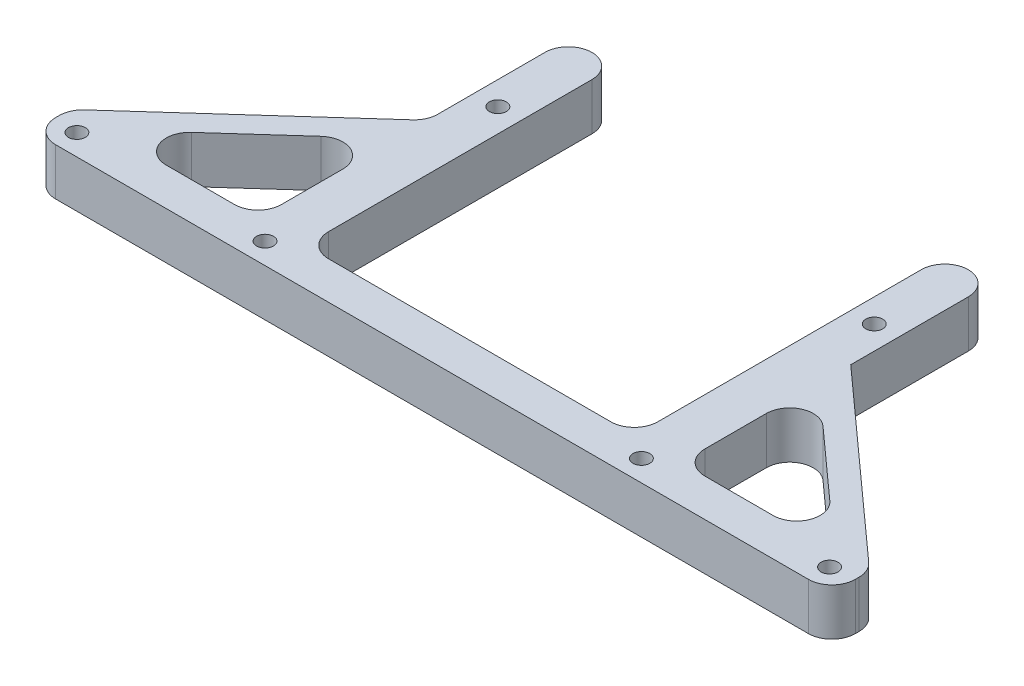
from build123d import *

# Parameters (mm, degrees)
SKETCH2_R           = 2.286
BOSS_EXTRUDE1_DEPTH = 12.7
FILLET1_R           = 6.35


with BuildPart() as part:
    # Sketch2 → Boss-Extrude1 (new body)
    with BuildSketch(Plane(origin=(0, 0, 0), x_dir=(1, 0, 0), z_dir=(0, 1, 0))):
        Polygon((107.95, 0), (-107.95, 0), (-107.95, 10.16), (-57.15, 55.88), (-57.15, 93.98), (-44.45, 93.98), (-44.45, 10.16), (44.45, 10.16), (44.45, 93.98), (57.15, 93.98), (57.15, 55.88), (107.95, 10.16), align=None)
        with Locations(Location((-50.8, 68.58, 0), (0, 0, 270))):
            Circle(SKETCH2_R, mode=Mode.SUBTRACT)
        with Locations(Location((50.8, 68.58, 0), (0, 0, 90))):
            Circle(SKETCH2_R, mode=Mode.SUBTRACT)
        with Locations(Location((-101.6, 5.715, 0), (0, 0, 270))):
            Circle(SKETCH2_R, mode=Mode.SUBTRACT)
        with Locations(Location((-50.8, 5.715, 0), (0, 0, 270))):
            Circle(SKETCH2_R, mode=Mode.SUBTRACT)
        with Locations(Location((101.6, 5.715, 0), (0, 0, 90))):
            Circle(SKETCH2_R, mode=Mode.SUBTRACT)
        with Locations(Location((50.8, 5.715, 0), (0, 0, 90))):
            Circle(SKETCH2_R, mode=Mode.SUBTRACT)
        Polygon((-57.15, 10.16), (-98.457720811, 10.16), (-57.15, 47.33694873), align=None, mode=Mode.SUBTRACT)
        Polygon((57.15, 47.33694873), (57.15, 10.16), (98.457720811, 10.16), align=None, mode=Mode.SUBTRACT)
    extrude(amount=BOSS_EXTRUDE1_DEPTH)

    # Fillet1
    fillet1_edges = [part.edges().sort_by_distance(p)[0] for p in [
        (57.15, 6.35, -93.98),
        (44.45, 6.35, -93.98),
        (-44.45, 6.35, -93.98),
        (-57.15, 6.35, -93.98),
        (-107.95, 6.35, -10.16),
        (-107.95, 6.35, 0),
        (107.95, 6.35, -10.16),
        (107.95, 6.35, 0),
        (98.457720811, 6.35, -10.16),
        (57.15, 6.35, -47.33694873),
        (57.15, 6.35, -10.16),
        (44.45, 6.35, -10.16),
        (-44.45, 6.35, -10.16),
        (-57.15, 6.35, -10.16),
        (-98.457720811, 6.35, -10.16),
        (-57.15, 6.35, -47.33694873),
        (-57.15, 6.35, -55.88),
    ]]
    fillet(fillet1_edges, radius=FILLET1_R - 0.0001)  # a hair under: the kernel refuses the full size


solid = part.part
